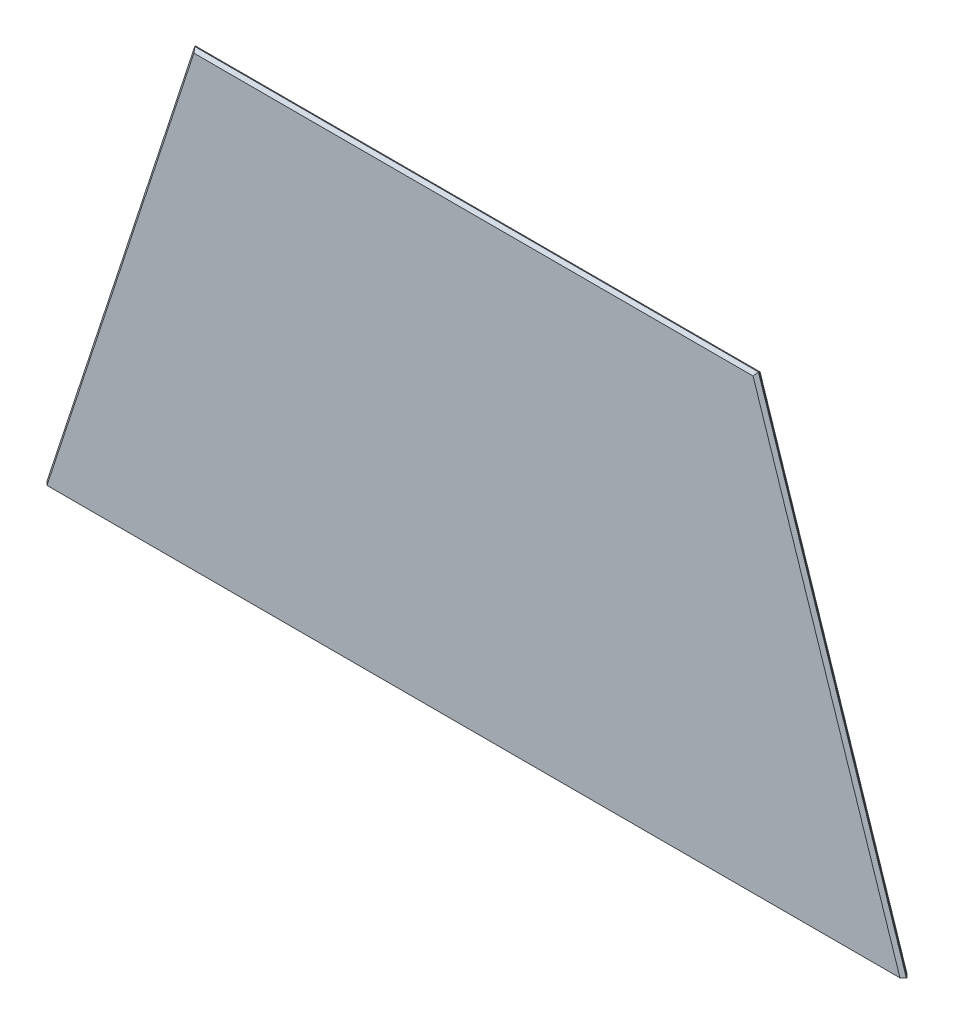
from build123d import *

# Parameters (mm, degrees)
EXTRUDE1_DEPTH = 1.5875
CHAMFER1_SIZE  = 1.397


with BuildPart() as part:
    # Sketch1 → Extrude1 (new, symmetric)
    with BuildSketch(Plane.XY):
        Polygon((0, 0), (193.675, 0), (127, 203.2), (0, 203.2), (-127, 203.2), (-193.675, 0), align=None)
    extrude(amount=EXTRUDE1_DEPTH, both=True)

    # Chamfer1
    chamfer1_edges = [part.edges().sort_by_distance(p)[0] for p in [
        (160.3375, 101.6, -1.5875),
        (0, 203.2, -1.5875),
        (-160.3375, 101.6, -1.5875),
        (160.3375, 101.6, 1.5875),
        (0, 203.2, 1.5875),
        (-160.3375, 101.6, 1.5875),
    ]]
    chamfer(chamfer1_edges, length=CHAMFER1_SIZE)


solid = part.part
